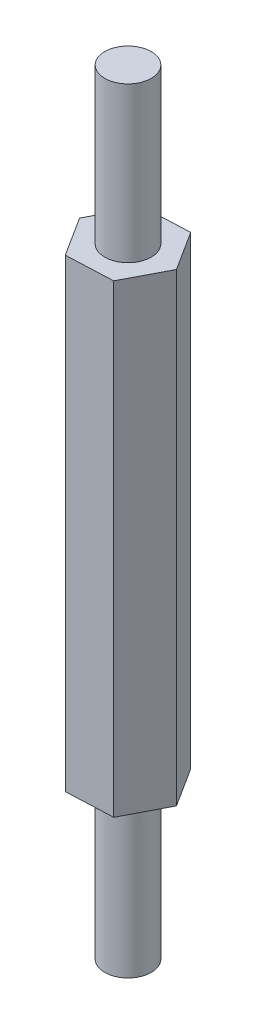
from build123d import *

# Parameters (mm, degrees)
BOSS_EXTRUDE1_DEPTH = 30
SKETCH4_R           = 1.5
BOSS_EXTRUDE2_DEPTH = 10
BOSS_EXTRUDE3_START = 10
SKETCH5_R           = 1.5
BOSS_EXTRUDE3_DEPTH = 10


with BuildPart() as part:
    # Sketch3 → Boss-Extrude1 (new body)
    with BuildSketch(Plane(origin=(0, 0, 0), x_dir=(1, 0, 0), z_dir=(0, 1, 0))):
        Polygon((1.388964752, 2.662182442), (-1.611035248, 2.533969981), (-3, -0.12821246), (-1.388964752, -2.662182442), (1.611035248, -2.533969981), (3, 0.12821246), align=None)
    extrude(amount=BOSS_EXTRUDE1_DEPTH)

    # Sketch4 → Boss-Extrude2 (add)
    with BuildSketch(Plane(origin=(0, 30, 0), x_dir=(1, 0, 0), z_dir=(0, 1, 0))):
        Circle(SKETCH4_R)
    extrude(amount=BOSS_EXTRUDE2_DEPTH)

    # Sketch5 → Boss-Extrude3 (add)
    with BuildSketch(Plane.XZ.offset(BOSS_EXTRUDE3_START)):
        Circle(SKETCH5_R)
    extrude(amount=-BOSS_EXTRUDE3_DEPTH)


solid = part.part
